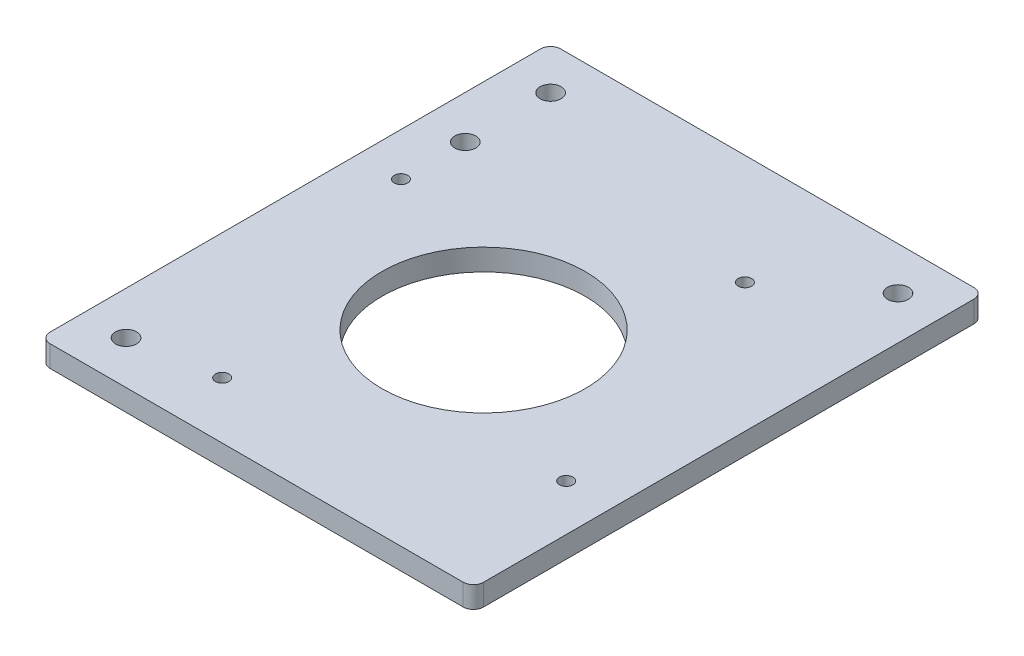
from build123d import *

# Parameters (mm, degrees)
SKETCH1_W           = 128
SKETCH1_H           = 150.8
SKETCH1_R           = 30
SKETCH1_R_2         = 3.1
BOSS_EXTRUDE1_DEPTH = 6.35
FILLET1_R           = 3
SKETCH3_R           = 1.985
CUT_EXTRUDE1_DEPTH  = 177.842091463


with BuildPart() as part:
    # Sketch1 → Boss-Extrude1 (new body)
    with BuildSketch(Plane(origin=(0, 0, 0), x_dir=(1, 0, 0), z_dir=(0, 1, 0))):
        with Locations((69.65857699, -40.22087878)):
            Rectangle(SKETCH1_W, SKETCH1_H)
        with Locations((69.15857699, -48.12087878)):
            Circle(SKETCH1_R, mode=Mode.SUBTRACT)
        with Locations((18.35857699, 22.47912122)):
            Circle(SKETCH1_R_2, mode=Mode.SUBTRACT)
        with Locations((120.95857699, 22.47912122)):
            Circle(SKETCH1_R_2, mode=Mode.SUBTRACT)
        with Locations((18.35857699, -102.92087878)):
            Circle(SKETCH1_R_2, mode=Mode.SUBTRACT)
        with Locations((18.35857699, -2.72087878)):
            Circle(SKETCH1_R_2, mode=Mode.SUBTRACT)
    extrude(amount=BOSS_EXTRUDE1_DEPTH)

    # Fillet1
    fillet1_edges = [part.edges().sort_by_distance(p)[0] for p in [
        (133.65857699, 3.175, -35.17912122),
        (133.65857699, 3.175, 115.62087878),
        (5.65857699, 3.175, 115.62087878),
        (5.65857699, 3.175, -35.17912122),
    ]]
    fillet(fillet1_edges, radius=FILLET1_R)

    # Sketch3 → Cut-Extrude1 (cut, through all)
    with BuildSketch(Plane(origin=(0, 6.35, 0), x_dir=(1, 0, 0), z_dir=(0, 1, 0))):
        with Locations((18.35857699, -21.727303805)):
            Circle(SKETCH3_R)
        with Locations((95.552151966, 2.67912122)):
            Circle(SKETCH3_R)
        with Locations((119.95857699, -74.514453756)):
            Circle(SKETCH3_R)
        with Locations((42.765002014, -98.92087878)):
            Circle(SKETCH3_R)
    extrude(amount=-CUT_EXTRUDE1_DEPTH, mode=Mode.SUBTRACT)


solid = part.part
